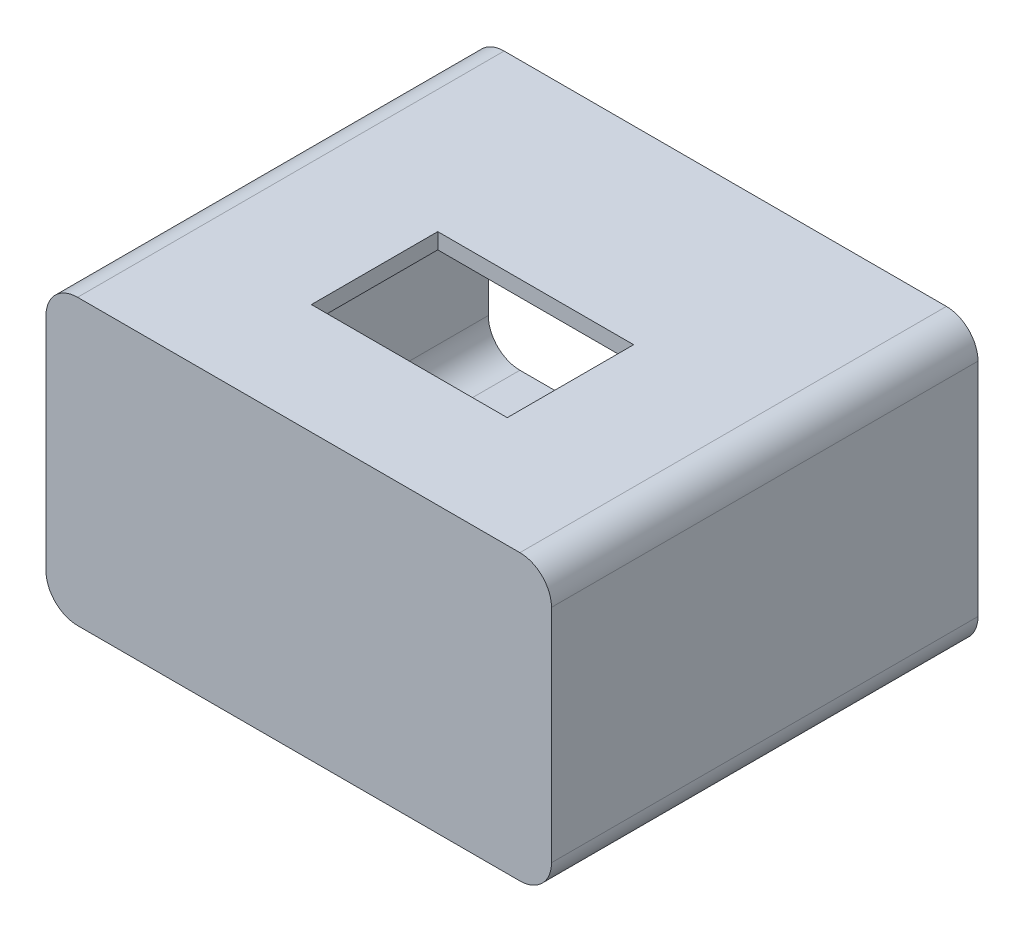
from build123d import *

# Parameters (mm, degrees)
BOSS_EXTRUDE1_DEPTH = 65
BOSS_EXTRUDE2_DEPTH = 2.5
CUT_EXTRUDE1_REACH  = 92.45
SKETCH4_W           = 31
SKETCH4_H           = 20


with BuildPart() as part:
    # Sketch2 → Boss-Extrude1 (new body)
    with BuildSketch(Plane.XY):
        with BuildLine():
            ThreePointArc((-40, -17.5), (-38.535533906, -21.035533906), (-35, -22.5))
            Line((-35, -22.5), (35, -22.5))
            ThreePointArc((35, -22.5), (38.535533906, -21.035533906), (40, -17.5))
            Line((40, -17.5), (40, 17.5))
            ThreePointArc((40, 17.5), (38.535533906, 21.035533906), (35, 22.5))
            Line((35, 22.5), (-35, 22.5))
            ThreePointArc((-35, 22.5), (-38.535533906, 21.035533906), (-40, 17.5))
            Line((-40, 17.5), (-40, -17.5))
        make_face()
        with BuildLine():
            ThreePointArc((37.5, -15), (36.035533906, -18.535533906), (32.5, -20))
            Line((32.5, -20), (-32.5, -20))
            ThreePointArc((-32.5, -20), (-36.035533906, -18.535533906), (-37.5, -15))
            Line((-37.5, -15), (-37.5, 15))
            ThreePointArc((-37.5, 15), (-36.035533906, 18.535533906), (-32.5, 20))
            Line((-32.5, 20), (32.5, 20))
            ThreePointArc((32.5, 20), (36.035533906, 18.535533906), (37.5, 15))
            Line((37.5, 15), (37.5, -15))
        make_face(mode=Mode.SUBTRACT)
    extrude(amount=BOSS_EXTRUDE1_DEPTH)

    # Sketch3 → Boss-Extrude2 (add)
    with BuildSketch(Plane.XY.offset(65)):
        with BuildLine():
            Line((-40, 17.5), (-40, -17.5))
            ThreePointArc((-40, -17.5), (-38.535533906, -21.035533906), (-35, -22.5))
            Line((-35, -22.5), (35, -22.5))
            ThreePointArc((35, -22.5), (38.535533906, -21.035533906), (40, -17.5))
            Line((40, -17.5), (40, 17.5))
            ThreePointArc((40, 17.5), (38.535533906, 21.035533906), (35, 22.5))
            Line((35, 22.5), (-35, 22.5))
            ThreePointArc((-35, 22.5), (-38.535533906, 21.035533906), (-40, 17.5))
        make_face()
    extrude(amount=BOSS_EXTRUDE2_DEPTH)

    # Sketch4 → Cut-Extrude1 (cut, up to next)
    with BuildSketch(Plane(origin=(0, 22.5, 0), x_dir=(1, 0, 0), z_dir=(0, 1, 0)), mode=Mode.PRIVATE) as cut_extrude1_sk1:
        with Locations((0, -40)):
            Rectangle(SKETCH4_W, SKETCH4_H)
    cut_extrude1_tool1 = extrude(cut_extrude1_sk1.sketch, amount=-CUT_EXTRUDE1_REACH, mode=Mode.PRIVATE) & part.part
    add(cut_extrude1_tool1.solids().sort_by_distance((0, 22.5, 40))[0], mode=Mode.SUBTRACT)


solid = part.part
